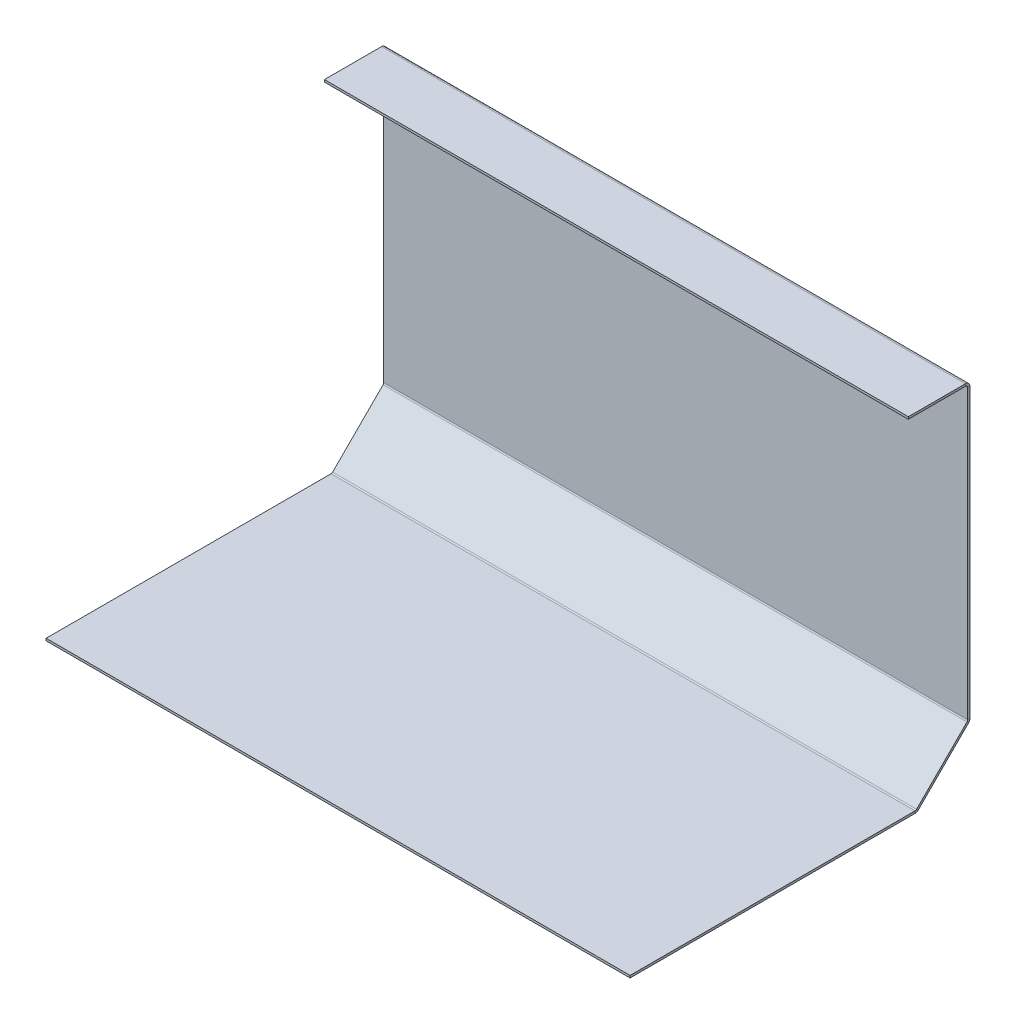
from build123d import *

# Parameters (mm, degrees)
SM_BASE_FLANGE_1_DEPTH = 192


# Sheet-metal steps are written as plain solids
with BuildPart() as part:
    # Sketch 1 → 基材-凸緣1 (new body)
    with BuildSketch(Plane(origin=(0, 0, 0), x_dir=(0, 0, -1), z_dir=(1, 0, 0))):
        with BuildLine():
            Line((-19.5, 112.6), (-0.7366, 112.6))
            ThreePointArc((-0.7366, 112.6), (-0.215745145, 112.384254855), (0, 111.8634))
            Line((0, 111.8634), (0, 17.30510971))
            ThreePointArc((0, 17.30510971), (-0.056070336, 17.023225094), (-0.215745145, 16.784254855))
            Line((-0.215745145, 16.784254855), (-16.784254855, 0.215745145))
            ThreePointArc((-16.784254855, 0.215745145), (-17.023225094, 0.056070336), (-17.30510971, 0))
            Line((-17.30510971, 0), (-111, 0))
            Line((-111, 0), (-111, -0.7366))
            Line((-111, -0.7366), (-17.30510971, -0.7366))
            ThreePointArc((-17.30510971, -0.7366), (-16.741340477, -0.624459327), (-16.2634, -0.30510971))
            Line((-16.2634, -0.30510971), (0.30510971, 16.2634))
            ThreePointArc((0.30510971, 16.2634), (0.624459327, 16.741340477), (0.7366, 17.30510971))
            Line((0.7366, 17.30510971), (0.7366, 111.8634))
            ThreePointArc((0.7366, 111.8634), (0.30510971, 112.90510971), (-0.7366, 113.3366))
            Line((-0.7366, 113.3366), (-19.5, 113.3366))
            Line((-19.5, 113.3366), (-19.5, 112.6))
        make_face()
    extrude(amount=SM_BASE_FLANGE_1_DEPTH)


solid = part.part
